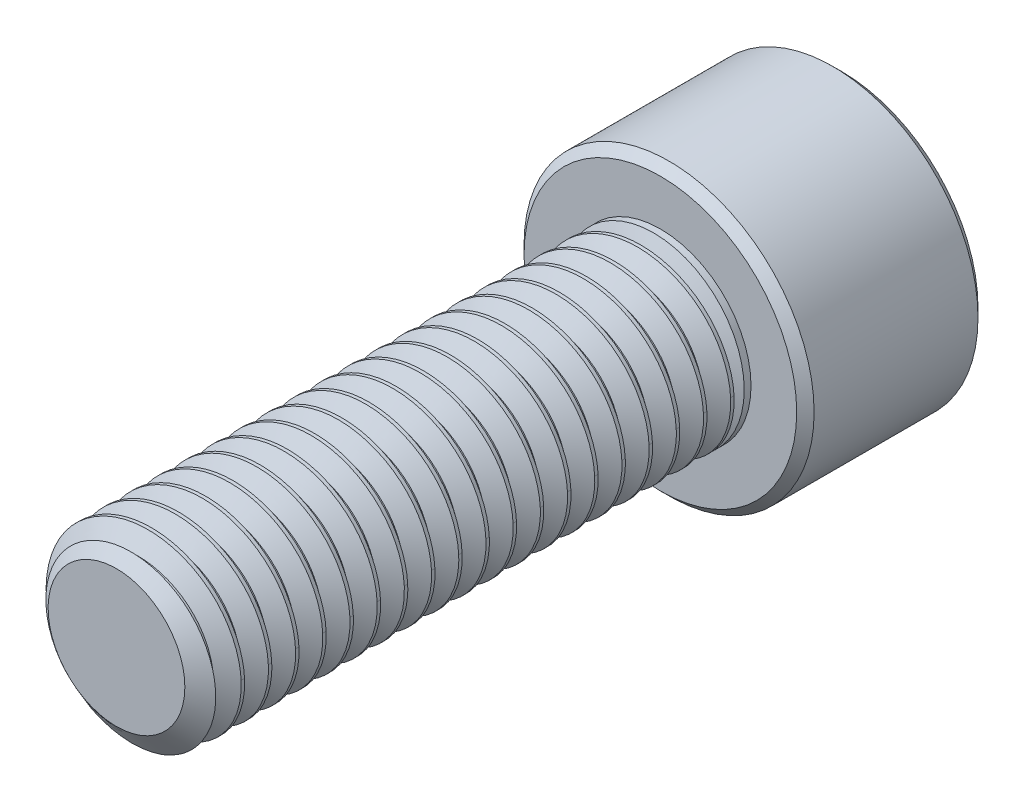
from build123d import *

# Parameters (mm, degrees)
SKETCH1_R          = 5
EXTRUDE1_DEPTH     = 30
CUT_SWEEP1_PITCH   = 1.5
SKETCH6_R          = 8
EXTRUDE2_DEPTH     = 10
CUT_EXTRUDE1_DEPTH = 6
CHAMFER1_SIZE      = 0.48


with BuildPart() as part:
    # Sketch1 → Extrude1 (new body)
    with BuildSketch(Plane.XY):
        Circle(SKETCH1_R)
    extrude(amount=-EXTRUDE1_DEPTH)

    # Cut-Sweep1: the profile of Sketch3 profile screwed along a right-hand helix of 21 turns, 6 arcs to a turn; built about Z, then put on its axis
    cut_sweep1_z = Axis((0, 0, 0), (0, 0, 1))
    cut_sweep1_corners = [(5.0003, 0, -1.312673205), (4.025721421, 0, -0.75), (4.025721421, 0, -0.5625), (5.0003, 0, 0.000173205)]
    with BuildLine(mode=Mode.PRIVATE) as cut_sweep1_profile:
        Line(cut_sweep1_corners[0], cut_sweep1_corners[1])
        Line(cut_sweep1_corners[1], cut_sweep1_corners[2])
        Line(cut_sweep1_corners[2], cut_sweep1_corners[3])
        Line(cut_sweep1_corners[3], cut_sweep1_corners[0])
    cut_sweep1_cap = Face(cut_sweep1_profile.wire())
    cut_sweep1_turn_angles = [0, 30, 60, 90, 120, 150, 180, 210, 240, 270, 300, 330, 360]
    cut_sweep1_turn_weights = [1, 0.8660254037844387, 1, 0.8660254037844387, 1, 0.8660254037844387, 1, 0.8660254037844387, 1, 0.8660254037844387, 1, 0.8660254037844387, 1]
    cut_sweep1_turn_rails = [Edge.make_bspline([Vector(p[0], p[1], 0).rotate(cut_sweep1_z, cut_sweep1_turn_angles[k]) / cut_sweep1_turn_weights[k] + Vector(0, 0, p[2] + CUT_SWEEP1_PITCH * cut_sweep1_turn_angles[k] / 360) for k in range(13)], [0, 0, 0, 1, 1, 2, 2, 3, 3, 4, 4, 5, 5, 6, 6, 6], 2, cut_sweep1_turn_weights) for p in cut_sweep1_corners]
    cut_sweep1_turn_sides = [Face.make_surface_from_curves(cut_sweep1_turn_rails[p[0]], cut_sweep1_turn_rails[p[1]]) for p in [(0, 1), (1, 2), (2, 3), (3, 0)]]
    cut_sweep1 = Plane(origin=(0, 0, 0), x_dir=(0, 1, 0), z_dir=(0, 0, -1)) * Solid(Shell([*[p.moved(Location((0, 0, CUT_SWEEP1_PITCH * i))) for i in range(21) for p in cut_sweep1_turn_sides], cut_sweep1_cap, cut_sweep1_cap.rotate(cut_sweep1_z, 7560).moved(Location((0, 0, CUT_SWEEP1_PITCH * 7560 / 360)))]))
    add(cut_sweep1, mode=Mode.SUBTRACT)

    # Sketch4 → Cut-Revolve1 (revolve, cut)
    with BuildSketch(Plane(origin=(0, 0, 0), x_dir=(0, 0, -1), z_dir=(1, 0, 0)), mode=Mode.PRIVATE) as cut_revolve1_sk:
        Polygon((0.86004992, 5), (0, 3.771721421), (0, 5), align=None)
    revolve(cut_revolve1_sk.sketch.rotate(Axis((0, 0, 0), (0, 0, -1)), 90), axis=Axis((0, 0, 0), (0, 0, -1)), mode=Mode.SUBTRACT)

    # Sketch6 → Extrude2 (add)
    with BuildSketch(Plane(origin=(0, 0, -30), x_dir=(-1, 0, 0), z_dir=(0, 0, -1))):
        Circle(SKETCH6_R)
    extrude(amount=EXTRUDE2_DEPTH)

    # Sketch7 → Cut-Extrude1 (cut)
    with BuildSketch(Plane(origin=(0, 0, -40), x_dir=(-1, 0, 0), z_dir=(0, 0, -1))):
        Polygon((0, 4.618802154), (-4, 2.309401077), (-4, -2.309401077), (0, -4.618802154), (4, -2.309401077), (4, 2.309401077), align=None)
    extrude(amount=-CUT_EXTRUDE1_DEPTH, mode=Mode.SUBTRACT)

    # Cut-Extrude2 cone 1 section (through the dimple's axis) → Cut-Extrude2 (revolve, cut)
    with BuildSketch(Plane(origin=(0, 0, -40), x_dir=(0, 1, 0), z_dir=(1, 0, 0))):
        Polygon((0, 0), (4.618802154, 0), (0, 4.618802154), align=None)
    revolve(axis=Axis((0, 0, -40), (0, 0, 1)), mode=Mode.SUBTRACT)

    # Chamfer1
    chamfer1_edges = [part.edges().sort_by_distance(p)[0] for p in [
        (8, 0, -30),
        (8, 0, -40),
    ]]
    chamfer(chamfer1_edges, length=CHAMFER1_SIZE)

    # Sketch10 → Revolve1 (revolve)
    with BuildSketch(Plane(origin=(0, 0, 0), x_dir=(0, 0, -1), z_dir=(1, 0, 0)), mode=Mode.PRIVATE) as revolve1_sk:
        Polygon((30, 5), (30, 0), (27.553932188, 0), (29.625, 5), align=None)
    revolve(revolve1_sk.sketch.rotate(Axis((0, 0, -30), (0, 0, 1)), 270), axis=Axis((0, 0, -30), (0, 0, 1)))


solid = part.part
